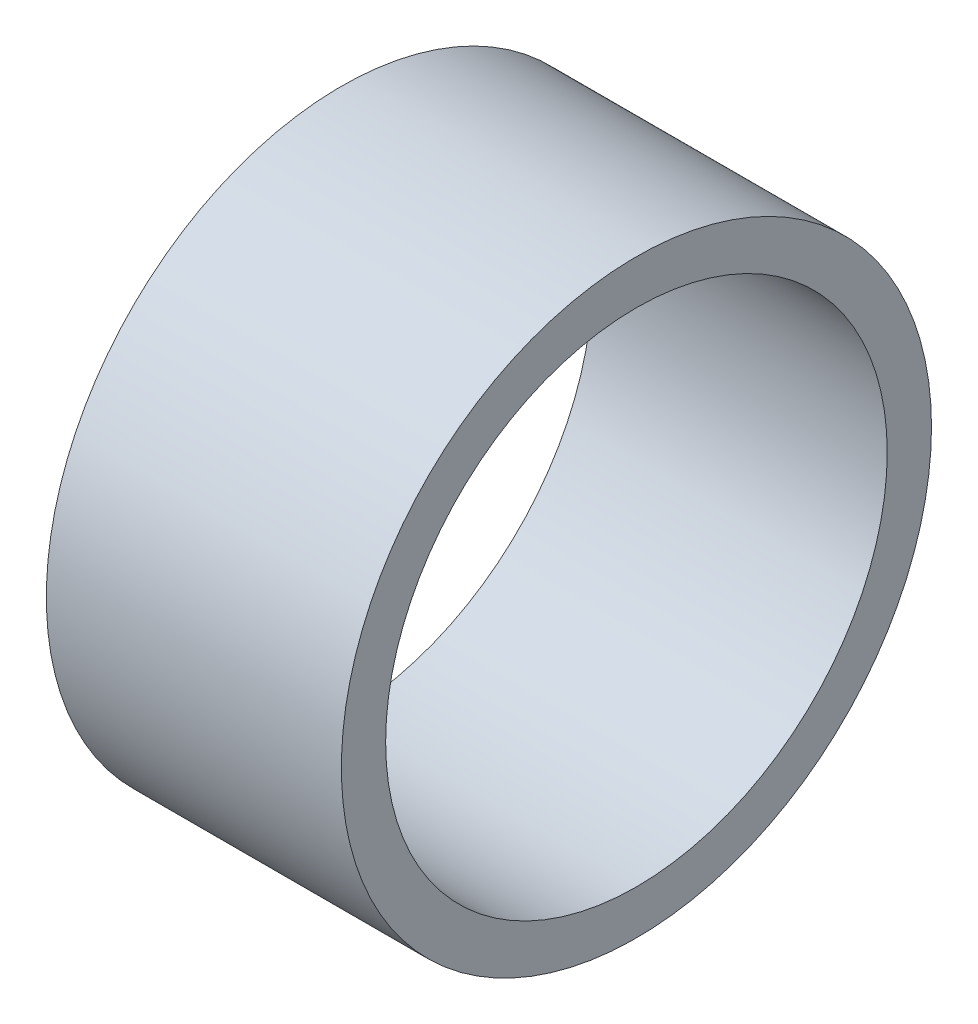
from build123d import *

# Parameters (mm, degrees)
SKETCH1_R           = 25.4
SKETCH1_R_2         = 21.59
BOSS_EXTRUDE1_DEPTH = 12.7


with BuildPart() as part:
    # Sketch1 → Boss-Extrude1 (new, symmetric)
    with BuildSketch(Plane(origin=(0, 0, 0), x_dir=(0, 0, -1), z_dir=(1, 0, 0))):
        Circle(SKETCH1_R)
        Circle(SKETCH1_R_2, mode=Mode.SUBTRACT)
    extrude(amount=BOSS_EXTRUDE1_DEPTH, both=True)


solid = part.part
